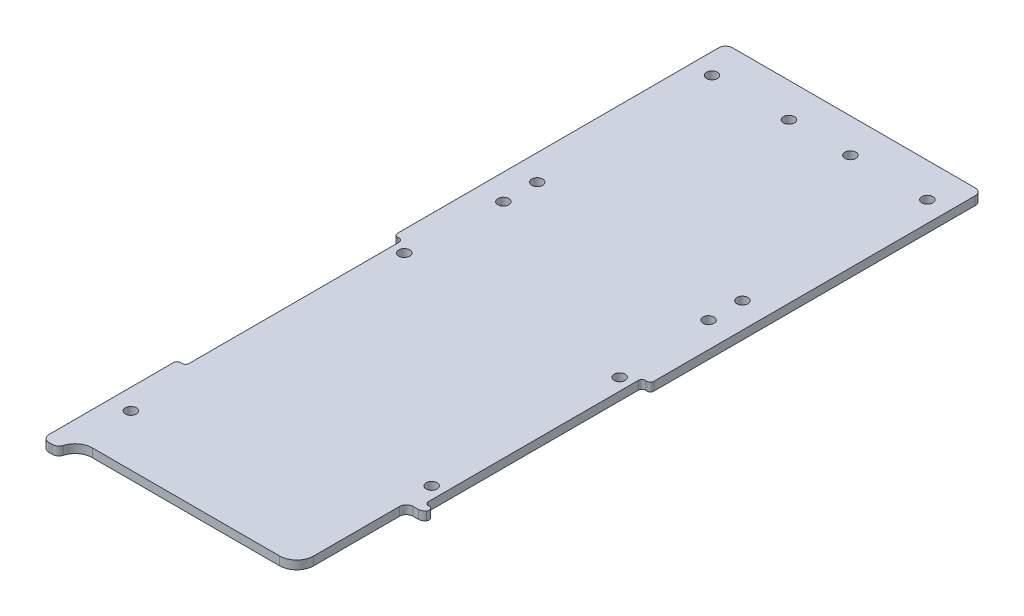
from build123d import *

# Parameters (mm, degrees)
SKETCH1_R               = 2.032
BOSS_EXTRUDE1_DEPTH     = 3.175
FILLET1_R               = 2.54
FILLET2_R               = 2.54
FILLET3_R               = 6.35
CUT_EXTRUDE1_DEPTH      = 136.673215063
FILLET4_R               = 6.35
FILLET5_R               = 2.54
SKETCH3_R               = 2.032
CUT_EXTRUDE2_DEPTH      = 136.673215063
CUT_EXTRUDE3_DEPTH      = 136.673215063
CUT_EXTRUDE3_DEPTH_BACK = 136.673215063
SKETCH4_W               = 3.175
SKETCH4_H               = 80.645
FILLET6_R               = 1.27


with BuildPart() as part:
    # Sketch1 → Boss-Extrude1 (new body)
    with BuildSketch(Plane(origin=(0, 0, 0), x_dir=(1, 0, 0), z_dir=(0, 1, 0))):
        Polygon((47.625, 127), (-47.625, 127), (-47.625, -127), (-41.275, -127), (-41.275, -120.65), (41.275, -120.65), (41.275, -127), (47.625, -127), align=None)
        with Locations((-39.999684148, -101.6)):
            Circle(SKETCH1_R, mode=Mode.SUBTRACT)
        with Locations((39.999684148, -69.85)):
            Circle(SKETCH1_R, mode=Mode.SUBTRACT)
        with Locations((-39.999684148, 0)):
            Circle(SKETCH1_R, mode=Mode.SUBTRACT)
        with Locations((-39.999684148, 114.3)):
            Circle(SKETCH1_R, mode=Mode.SUBTRACT)
        with Locations((-11.424684148, 114.3)):
            Circle(SKETCH1_R, mode=Mode.SUBTRACT)
        with Locations((39.999684148, 0)):
            Circle(SKETCH1_R, mode=Mode.SUBTRACT)
        with Locations((11.424684148, 114.3)):
            Circle(SKETCH1_R, mode=Mode.SUBTRACT)
        with Locations((39.999684148, 114.3)):
            Circle(SKETCH1_R, mode=Mode.SUBTRACT)
    extrude(amount=BOSS_EXTRUDE1_DEPTH)

    # Fillet1
    fillet1_edges = [part.edges().sort_by_distance(p)[0] for p in [
        (-47.625, 1.5875, -127),
        (47.625, 1.5875, -127),
        (47.625, 1.5875, 127),
        (-47.625, 1.5875, 127),
    ]]
    fillet(fillet1_edges, radius=FILLET1_R)

    # Fillet2
    fillet2_edges = [part.edges().sort_by_distance(p)[0] for p in [
        (41.275, 1.5875, 127),
        (-41.275, 1.5875, 127),
    ]]
    fillet(fillet2_edges, radius=FILLET2_R)

    # Fillet3
    fillet3_edges = [part.edges().sort_by_distance(p)[0] for p in [
        (41.275, 1.5875, 120.65),
        (-41.275, 1.5875, 120.65),
    ]]
    fillet(fillet3_edges, radius=FILLET3_R)

    # Sketch2 → Cut-Extrude1 (cut, through all)
    with BuildSketch(Plane.XZ):
        with BuildLine():
            Line((40.64508, 123.578690235), (40.64508, 79.88808))
            Line((40.64508, 79.88808), (47.625, 79.88808))
            Line((47.625, 79.88808), (47.625, 124.46))
            ThreePointArc((47.625, 124.46), (46.881051224, 126.256051224), (45.085, 127))
            Line((45.085, 127), (43.815, 127))
            ThreePointArc((43.815, 127), (42.297059666, 126.496530663), (41.380880287, 125.185714286))
            ThreePointArc((41.380880287, 125.185714286), (41.069166069, 124.356476684), (40.64508, 123.578690235))
        make_face()
    extrude(amount=-CUT_EXTRUDE1_DEPTH, mode=Mode.SUBTRACT)

    # Fillet4
    fillet4_edges = [part.edges().sort_by_distance(p)[0] for p in [
        (40.64508, 1.5875, 123.578690235),
    ]]
    fillet(fillet4_edges, radius=FILLET4_R)

    # Fillet5
    fillet5_edges = [part.edges().sort_by_distance(p)[0] for p in [
        (47.625, 1.5875, 79.88808),
        (40.64508, 1.5875, 79.88808),
    ]]
    fillet(fillet5_edges, radius=FILLET5_R)

    # Sketch3 → Cut-Extrude2 (cut, through all)
    with BuildSketch(Plane.XZ):
        with Locations((-38.109360415, -34.913768806)):
            Circle(SKETCH3_R)
        with Locations((-38.109360415, -47.490173279)):
            Circle(SKETCH3_R)
        with Locations((38.109360415, -47.490173279)):
            Circle(SKETCH3_R)
        with Locations((38.109360415, -34.913768806)):
            Circle(SKETCH3_R)
    extrude(amount=-CUT_EXTRUDE2_DEPTH, mode=Mode.SUBTRACT)

    # Sketch4 → Cut-Extrude3 (cut, two sides: drawn at the far end of the back side and taken through both)
    with BuildSketch(Plane(origin=(0, 3.175, 0), x_dir=(1, 0, 0), z_dir=(0, 1, 0)).offset(-CUT_EXTRUDE3_DEPTH_BACK)):
        with Locations((-46.0375, -36.5125)):
            Rectangle(SKETCH4_W, SKETCH4_H)
        with Locations((46.0375, -36.5125)):
            Rectangle(SKETCH4_W, SKETCH4_H)
    extrude(amount=CUT_EXTRUDE3_DEPTH + CUT_EXTRUDE3_DEPTH_BACK, mode=Mode.SUBTRACT)

    # Fillet6
    fillet6_edges = [part.edges().sort_by_distance(p)[0] for p in [
        (-44.45, 1.5875, -3.81),
        (-47.625, 1.5875, -3.81),
        (-47.625, 1.5875, 76.835),
        (-44.45, 1.5875, 76.835),
        (44.45, 1.5875, 76.835),
        (47.625, 1.5875, 76.835),
        (44.45, 1.5875, -3.81),
        (47.625, 1.5875, -3.81),
    ]]
    fillet(fillet6_edges, radius=FILLET6_R)


solid = part.part
